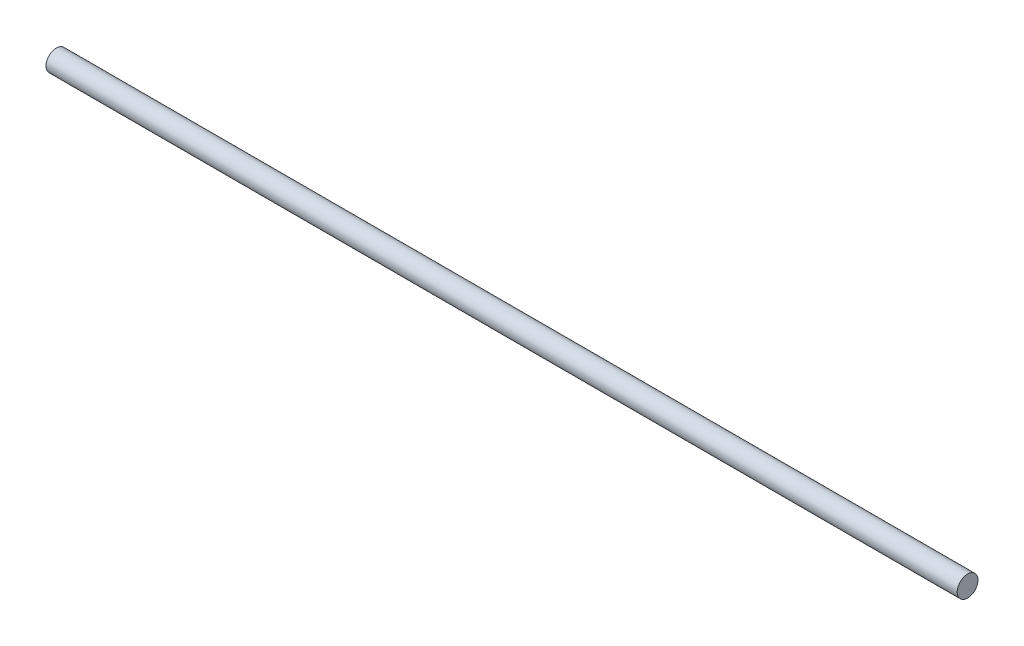
from build123d import *

# Parameters (mm, degrees)
SKETCH1_R           = 4
BOSS_EXTRUDE1_DEPTH = 175


with BuildPart() as part:
    # Sketch1 → Boss-Extrude1 (new, symmetric)
    with BuildSketch(Plane(origin=(0, 0, 0), x_dir=(0, 0, -1), z_dir=(1, 0, 0))):
        Circle(SKETCH1_R)
    extrude(amount=BOSS_EXTRUDE1_DEPTH, both=True)


solid = part.part
